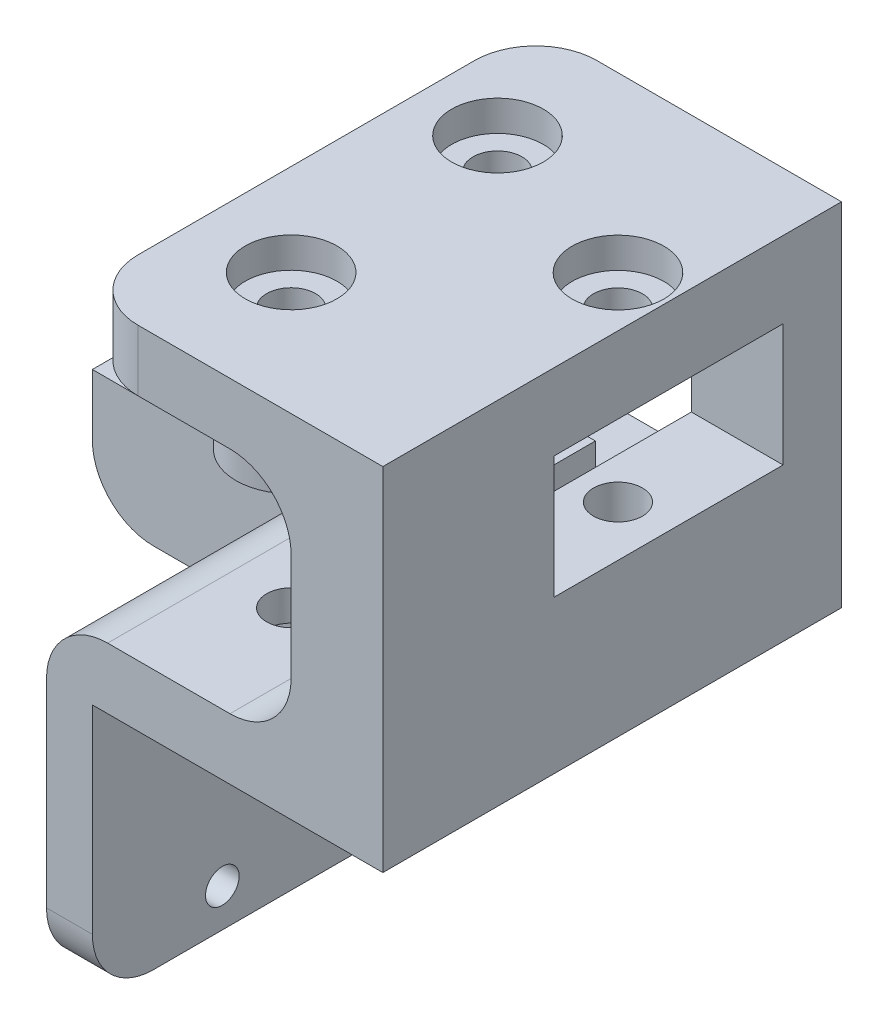
from build123d import *

# Parameters (mm, degrees)
RESSALTO_EXTRUS_O1_DEPTH    = 30
CORTE_EXTRUS_O1_DEPTH       = 54.488316481
CORTE_EXTRUS_O1_DEPTH_BACK  = 54.488316481
ESBO_O3_R                   = 1.1
CORTE_EXTRUS_O6_DEPTH       = 54.488316481
CORTE_EXTRUS_O6_DEPTH_BACK  = 54.488316481
ESBO_O4_W                   = 12
ESBO_O4_H                   = 15
ESBO_O5_R                   = 1.6
CORTE_EXTRUS_O7_DEPTH       = 54.488316481
CORTE_EXTRUS_O9_START       = 6
ESBO_O7_W                   = 15
ESBO_O7_H                   = 15
CORTE_EXTRUS_O9_DEPTH       = 8
CORTE_EXTRUS_O11_REACH      = 55.488
ESBO_O9_R                   = 1.6
ESBO_O8_R                   = 3
CORTE_EXTRUS_O10_DEPTH      = 2
CORTE_EXTRUS_O14_DEPTH      = 43.308391603
CORTE_EXTRUS_O14_DEPTH_BACK = 2
CORTE_EXTRUS_O16_DEPTH      = 55.626001135
CORTE_EXTRUS_O16_DEPTH_BACK = 1
ESBO_O15_R                  = 2.1
FILETE1_R                   = 4
ESBO_O16_W                  = 10
ESBO_O16_H                  = 3.82
RESSALTO_EXTRUS_O2_DEPTH    = 2
ESBO_O17_W                  = 15.9
ESBO_O17_H                  = 2.8
RESSALTO_EXTRUS_O3_DEPTH    = 3.5
ESBO_O18_W                  = 52.248887689
ESBO_O18_H                  = 54.313207189
CORTE_EXTRUS_O17_DEPTH      = 34
ESBO_O19_R                  = 3.6
ESBO_O19_R_2                = 1.6
RESSALTO_EXTRUS_O4_DEPTH    = 6


with BuildPart() as part:
    # Esboço1 → Ressalto-extrusão1 (new body)
    with BuildSketch(Plane.XY):
        with BuildLine():
            Line((0, 0), (3, 0))
            Line((3, 0), (3, 8))
            ThreePointArc((3, 8), (4.464466094, 11.535533906), (8, 13))
            Line((8, 13), (15, 13))
            Line((15, 13), (15, 21))
            Line((15, 21), (-13, 21))
            Line((-13, 21), (-13, 36))
            Line((-13, 36), (1, 36))
            Line((1, 36), (1, 40))
            Line((1, 40), (-19, 40))
            Line((-19, 40), (-19, 17))
            Line((-19, 17), (0, 17))
            Line((0, 17), (0, 0))
        make_face()
    extrude(amount=RESSALTO_EXTRUS_O1_DEPTH)

    # Esboço3 → Corte-extrusão1 (cut, two sides: drawn at the far end of the back side and taken through both)
    with BuildSketch(Plane(origin=(0, 0, 0), x_dir=(0, 0, -1), z_dir=(1, 0, 0)).offset(-CORTE_EXTRUS_O1_DEPTH_BACK)):
        with Locations((-8.5, 14.5)):
            Circle(ESBO_O3_R)
        with Locations(Location((-21.5, 14.5, 0), (0, 0, 90))):
            Circle(ESBO_O3_R)
        with Locations(Location((-8.5, 2.5, 0), (0, 0, 90))):
            Circle(ESBO_O3_R)
        with Locations(Location((-21.5, 2.5, 0), (0, 0, 90))):
            Circle(ESBO_O3_R)
    extrude(amount=CORTE_EXTRUS_O1_DEPTH + CORTE_EXTRUS_O1_DEPTH_BACK, mode=Mode.SUBTRACT)

    # Esboço4 → Corte-extrusão6 (cut, two sides: drawn at the far end of the back side and taken through both)
    with BuildSketch(Plane(origin=(0, 0, 0), x_dir=(1, 0, 0), z_dir=(0, 1, 0)).offset(-CORTE_EXTRUS_O6_DEPTH_BACK)):
        with Locations((9, -22.5)):
            Rectangle(ESBO_O4_W, ESBO_O4_H)
    extrude(amount=CORTE_EXTRUS_O6_DEPTH + CORTE_EXTRUS_O6_DEPTH_BACK, mode=Mode.SUBTRACT)

    # Esboço5 → Corte-extrusão7 (cut, through all)
    with BuildSketch(Plane(origin=(0, 40, 0), x_dir=(1, 0, 0), z_dir=(0, 1, 0))):
        with Locations(Location((-5, -22, 0), (0, 0, 270))):
            Circle(ESBO_O5_R)
        with Locations(Location((-15.7, -11.32, 0), (0, 0, 180))):
            Circle(ESBO_O5_R)
        with Locations(Location((11, -7.5, 0), (0, 0, 180))):
            Circle(ESBO_O5_R)
    extrude(amount=-CORTE_EXTRUS_O7_DEPTH, mode=Mode.SUBTRACT)

    # Esboço7 → Corte-extrusão9 (cut)
    with BuildSketch(Plane(origin=(0, 21, 0), x_dir=(1, 0, 0), z_dir=(0, 1, 0)).offset(CORTE_EXTRUS_O9_START)):
        with Locations((-15.7, -11.32)):
            Rectangle(ESBO_O7_W, ESBO_O7_H)
    extrude(amount=CORTE_EXTRUS_O9_DEPTH, mode=Mode.SUBTRACT)

    # Esboço9 → Corte-extrusão11 (cut, up to next)
    with BuildSketch(Plane(origin=(0, 40, 0), x_dir=(1, 0, 0), z_dir=(0, 1, 0)), mode=Mode.PRIVATE) as corte_extrus_o11_sk1:
        with Locations(Location((-4, -7.5, 0), (0, 0, 180))):
            Circle(ESBO_O9_R)
    corte_extrus_o11_tool1 = extrude(corte_extrus_o11_sk1.sketch, amount=-CORTE_EXTRUS_O11_REACH, mode=Mode.PRIVATE) & part.part
    add(corte_extrus_o11_tool1.solids().sort_by_distance((-4, 40, 7.5))[0], mode=Mode.SUBTRACT)

    # Esboço8 → Corte-extrusão10 (cut)
    with BuildSketch(Plane(origin=(0, 40, 0), x_dir=(1, 0, 0), z_dir=(0, 1, 0))):
        with Locations(Location((-15.7, -11.32, 0), (0, 0, 180))):
            Circle(ESBO_O8_R)
        with Locations(Location((-5, -22, 0), (0, 0, 180))):
            Circle(ESBO_O8_R)
        with Locations(Location((-4, -7.5, 0), (0, 0, 180))):
            Circle(ESBO_O8_R)
    extrude(amount=-CORTE_EXTRUS_O10_DEPTH, mode=Mode.SUBTRACT)

    # Esboço14 → Corte-extrusão14 (cut, two sides: drawn at the far end of the back side and taken through both)
    with BuildSketch(Plane.XZ.offset(-17).offset(-CORTE_EXTRUS_O14_DEPTH_BACK)):
        with BuildLine():
            Line((11, 11), (15, 11))
            Line((15, 11), (15, 4))
            Line((15, 4), (11, 4))
            ThreePointArc((11, 4), (7.5, 7.5), (11, 11))
        make_face()
        Polygon((-5, 25.233161507), (-7.8, 23.616580754), (-7.8, 20.383419246), (-5, 18.766838493), (-2.2, 20.383419246), (-2.2, 23.616580754), align=None)
        Polygon((-15.7, 14.553161507), (-18.5, 12.936580754), (-18.5, 9.703419246), (-15.7, 8.086838493), (-12.9, 9.703419246), (-12.9, 12.936580754), align=None)
    extrude(amount=CORTE_EXTRUS_O14_DEPTH + CORTE_EXTRUS_O14_DEPTH_BACK, mode=Mode.SUBTRACT)

    # Esboço15 → Corte-extrusão16 (cut, two sides: drawn at the far end of the back side and taken through both)
    with BuildSketch(Plane(origin=(3, 0, 0), x_dir=(0, 0, -1), z_dir=(1, 0, 0)).offset(-CORTE_EXTRUS_O16_DEPTH_BACK)):
        with Locations(Location((-21.5, 14.5, 0), (0, 0, 90))):
            Circle(ESBO_O15_R)
        with Locations(Location((-8.5, 14.5, 0), (0, 0, 313.540252108))):
            Circle(ESBO_O15_R)
        with Locations(Location((-8.5, 2.5, 0), (0, 0, 90))):
            Circle(ESBO_O15_R)
        with Locations(Location((-21.5, 2.5, 0), (0, 0, 90))):
            Circle(ESBO_O15_R)
    extrude(amount=CORTE_EXTRUS_O16_DEPTH + CORTE_EXTRUS_O16_DEPTH_BACK, mode=Mode.SUBTRACT)

    # Filete1
    # the kernel refuses this fillet: 4 mm, written as the material it adds along each edge
    with BuildSketch(Plane(origin=(-13, 21, 0), x_dir=(1, 0, 0), z_dir=(0, 0, 1))) as filete1_piece_1:
        with BuildLine():
            CenterArc((FILETE1_R, FILETE1_R), FILETE1_R, 180, 90)
            Line((0, FILETE1_R), (0, 0))
            Line((0, 0), (FILETE1_R, 0))
        make_face()
    extrude(amount=30)
    with BuildSketch(Plane(origin=(-13, 36, 0), x_dir=(1, 0, 0), z_dir=(0, 0, 1))) as filete1_piece_2_section:
        with BuildLine():
            CenterArc((FILETE1_R, -FILETE1_R), FILETE1_R, 90, 90)
            Line((0, -FILETE1_R), (0, 0))
            Line((0, 0), (FILETE1_R, 0))
        make_face()
    filete1_piece_2 = extrude(amount=30, mode=Mode.PRIVATE)
    filete1_piece_2 = split(filete1_piece_2, bisect_by=Plane(origin=(-11.759467995, 35, 1.91), z_dir=(0, 1, 0)), keep=Keep.TOP, mode=Mode.PRIVATE)
    filete1_piece_2 = split(filete1_piece_2, bisect_by=Plane(origin=(-11.759467995, 35.634662641, 3.82), z_dir=(0, 0, -1)), keep=Keep.TOP, mode=Mode.PRIVATE)
    add(filete1_piece_2)
    with BuildSketch(Plane(origin=(-13, 36, 0), x_dir=(1, 0, 0), z_dir=(0, 0, 1))) as filete1_piece_3_section:
        with BuildLine():
            CenterArc((FILETE1_R, -FILETE1_R), FILETE1_R, 90, 90)
            Line((0, -FILETE1_R), (0, 0))
            Line((0, 0), (FILETE1_R, 0))
        make_face()
    filete1_piece_3 = extrude(amount=30, mode=Mode.PRIVATE)
    filete1_piece_3 = split(filete1_piece_3, bisect_by=Plane(origin=(-12.678584174, 35, 1.91), z_dir=(0, -1, 0)), keep=Keep.TOP, mode=Mode.PRIVATE)
    filete1_piece_3 = split(filete1_piece_3, bisect_by=Plane(origin=(-12.678584174, 34.15222085, 3.82), z_dir=(0, 0, -1)), keep=Keep.TOP, mode=Mode.PRIVATE)
    add(filete1_piece_3)
    with BuildSketch(Plane(origin=(-13, 36, 0), x_dir=(1, 0, 0), z_dir=(0, 0, 1))) as filete1_piece_4_section:
        with BuildLine():
            CenterArc((FILETE1_R, -FILETE1_R), FILETE1_R, 90, 90)
            Line((0, -FILETE1_R), (0, 0))
            Line((0, 0), (FILETE1_R, 0))
        make_face()
    filete1_piece_4 = extrude(amount=30, mode=Mode.PRIVATE)
    filete1_piece_4 = split(filete1_piece_4, bisect_by=Plane(origin=(-11.759467995, 35, 11.32), z_dir=(0, 1, 0)), keep=Keep.TOP, mode=Mode.PRIVATE)
    filete1_piece_4 = split(filete1_piece_4, bisect_by=Plane(origin=(-11.759467995, 35.634662641, 3.82), z_dir=(0, 0, 1)), keep=Keep.TOP, mode=Mode.PRIVATE)
    filete1_piece_4 = split(filete1_piece_4, bisect_by=Plane(origin=(-11.759467995, 35.634662641, 18.82), z_dir=(0, 0, -1)), keep=Keep.TOP, mode=Mode.PRIVATE)
    add(filete1_piece_4)
    with BuildSketch(Plane(origin=(-13, 36, 0), x_dir=(1, 0, 0), z_dir=(0, 0, 1))) as filete1_piece_5_section:
        with BuildLine():
            CenterArc((FILETE1_R, -FILETE1_R), FILETE1_R, 90, 90)
            Line((0, -FILETE1_R), (0, 0))
            Line((0, 0), (FILETE1_R, 0))
        make_face()
    filete1_piece_5 = extrude(amount=30, mode=Mode.PRIVATE)
    filete1_piece_5 = split(filete1_piece_5, bisect_by=Plane(origin=(-11.759467995, 35, 24.41), z_dir=(0, 1, 0)), keep=Keep.TOP, mode=Mode.PRIVATE)
    filete1_piece_5 = split(filete1_piece_5, bisect_by=Plane(origin=(-11.759467995, 35.634662641, 18.82), z_dir=(0, 0, 1)), keep=Keep.TOP, mode=Mode.PRIVATE)
    add(filete1_piece_5)
    with BuildSketch(Plane(origin=(-13, 36, 0), x_dir=(1, 0, 0), z_dir=(0, 0, 1))) as filete1_piece_6_section:
        with BuildLine():
            CenterArc((FILETE1_R, -FILETE1_R), FILETE1_R, 90, 90)
            Line((0, -FILETE1_R), (0, 0))
            Line((0, 0), (FILETE1_R, 0))
        make_face()
    filete1_piece_6 = extrude(amount=30, mode=Mode.PRIVATE)
    filete1_piece_6 = split(filete1_piece_6, bisect_by=Plane(origin=(-12.678584174, 35, 24.41), z_dir=(0, -1, 0)), keep=Keep.TOP, mode=Mode.PRIVATE)
    filete1_piece_6 = split(filete1_piece_6, bisect_by=Plane(origin=(-12.678584174, 34.15222085, 18.82), z_dir=(0, 0, 1)), keep=Keep.TOP, mode=Mode.PRIVATE)
    add(filete1_piece_6)
    # the kernel refuses this fillet: 4 mm, written as the material it takes off along each edge
    with BuildSketch(Plane(origin=(-10, 0, 0), x_dir=(0, 0, 1), z_dir=(1, 0, 0))) as filete1_2_piece_1:
        with BuildLine():
            CenterArc((FILETE1_R, -FILETE1_R), FILETE1_R, 90, 90)
            Line((0, -FILETE1_R), (0, 0))
            Line((0, 0), (FILETE1_R, 0))
        make_face()
    extrude(amount=23, mode=Mode.SUBTRACT)
    with BuildSketch(Plane(origin=(-10, 0, 30), x_dir=(0, 0, -1), z_dir=(1, 0, 0))) as filete1_2_piece_2:
        with BuildLine():
            CenterArc((FILETE1_R, FILETE1_R), FILETE1_R, 180, 90)
            Line((0, FILETE1_R), (0, 0))
            Line((0, 0), (FILETE1_R, 0))
        make_face()
    extrude(amount=23, mode=Mode.SUBTRACT)
    with BuildSketch(Plane(origin=(3, 21, 15), x_dir=(-1, 0, 0), z_dir=(0, 0, 1))) as filete1_2_piece_3:
        with BuildLine():
            CenterArc((FILETE1_R, FILETE1_R), FILETE1_R, 180, 90)
            Line((0, FILETE1_R), (0, 0))
            Line((0, 0), (FILETE1_R, 0))
        make_face()
    extrude(amount=25, mode=Mode.SUBTRACT)
    with BuildSketch(Plane(origin=(1, 26, 0), x_dir=(0, 0, 1), z_dir=(0, 1, 0)), Plane(origin=(15, 13, -10), x_dir=(-1, 0, 0), z_dir=(0, 0, 1)), Plane(origin=(15, 13, 1), x_dir=(-1, 0, 0), z_dir=(0, 0, 1))) as filete1_2_piece_4:
        with BuildLine():
            CenterArc((FILETE1_R, -FILETE1_R), FILETE1_R, 90, 90)
            Line((0, -FILETE1_R), (0, 0))
            Line((0, 0), (FILETE1_R, 0))
        make_face()
    extrude(amount=24, mode=Mode.SUBTRACT)
    with BuildSketch(Plane(origin=(1, 26, 30), x_dir=(0, 0, -1), z_dir=(0, 1, 0))) as filete1_2_piece_5:
        with BuildLine():
            CenterArc((FILETE1_R, FILETE1_R), FILETE1_R, 180, 90)
            Line((0, FILETE1_R), (0, 0))
            Line((0, 0), (FILETE1_R, 0))
        make_face()
    extrude(amount=24, mode=Mode.SUBTRACT)

    # Esboço16 → Ressalto-extrusão2 (add)
    with BuildSketch(Plane(origin=(0, 21, 0), x_dir=(1, 0, 0), z_dir=(0, 1, 0))):
        with Locations((-14, -1.91)):
            Rectangle(ESBO_O16_W, ESBO_O16_H)
    extrude(amount=RESSALTO_EXTRUS_O2_DEPTH)

    # Esboço17 → Ressalto-extrusão3 (add)
    with BuildSketch(Plane(origin=(0, 21, 0), x_dir=(1, 0, 0), z_dir=(0, 1, 0))):
        with Locations((-1.05, -7.5)):
            Rectangle(ESBO_O17_W, ESBO_O17_H)
    extrude(amount=RESSALTO_EXTRUS_O3_DEPTH)

    # Espelhar1: part across plane


with BuildPart() as part_1:
    add(part.part)
    add(part.part.mirror(Plane(origin=(15, 21, 30), x_dir=(0, 0, 1), z_dir=(-1, 0, 0))))

    # Esboço18 → Corte-extrusão17 (cut)
    with BuildSketch(Plane.ZY.offset(19)):
        with Locations((14.699236255, 19.293263453)):
            Rectangle(ESBO_O18_W, ESBO_O18_H)
    extrude(amount=-CORTE_EXTRUS_O17_DEPTH, mode=Mode.SUBTRACT)

    # Esboço19 → Ressalto-extrusão4 (add)
    with BuildSketch(Plane.XZ.offset(-36)):
        with Locations(Location((35, 22, 0), (0, 0, 180))):
            Circle(ESBO_O19_R)
        with Locations(Location((35, 22, 0), (0, 0, 270))):
            Circle(ESBO_O19_R_2, mode=Mode.SUBTRACT)
    extrude(amount=RESSALTO_EXTRUS_O4_DEPTH)


solid = part_1.part
